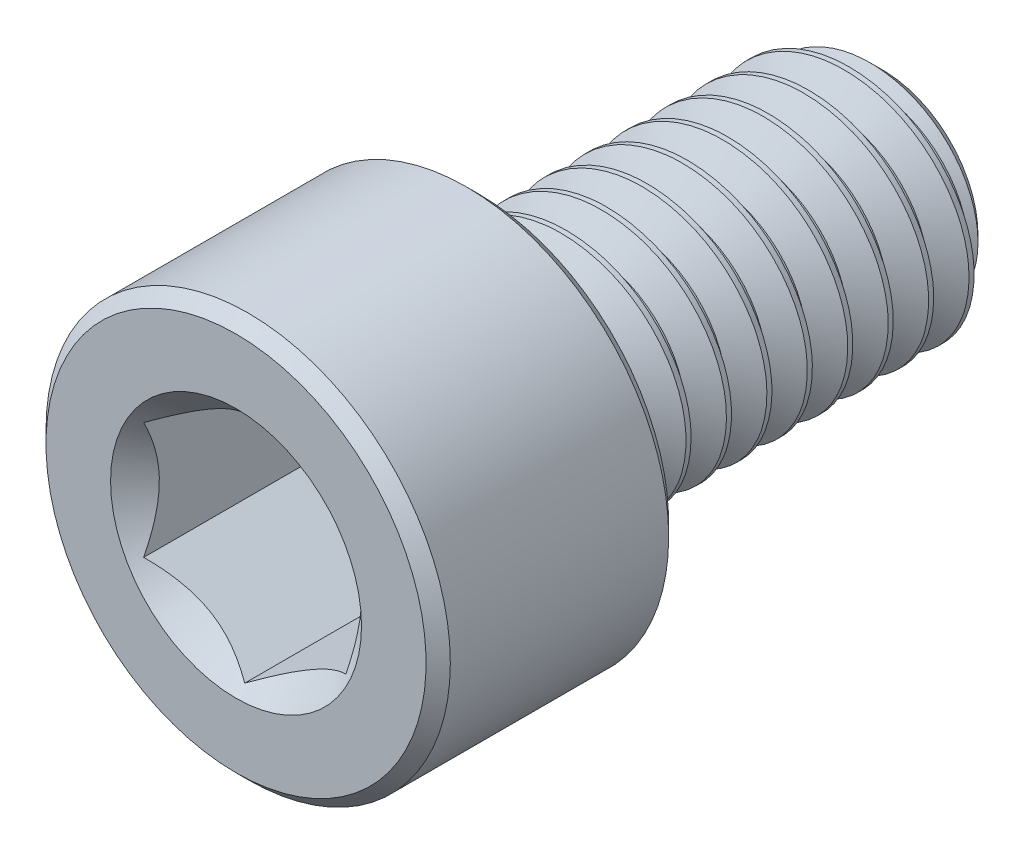
from build123d import *

# Parameters (mm, degrees)
CUT_EXTRUDE1_DEPTH     = 5
SKETCH4_R              = 3.103257697
CUT_EXTRUDE2_DEPTH     = 3
CUT_EXTRUDE2_DRAFT     = -45
SPLIT1_SURFACE_1_BACK  = 22.354
SPLIT1_SURFACE_1_DEPTH = 44.708
SPLIT1_SURFACE_2_BACK  = 22.354
SPLIT1_SURFACE_2_DEPTH = 44.708
CUT_SWEEP1_PITCH       = 1


with BuildPart() as part:
    # Sketch2 → Revolve1 (revolve)
    with BuildSketch(Plane(origin=(0, 0, 0), x_dir=(0, 0, -1), z_dir=(1, 0, 0))):
        with BuildLine():
            Line((-8, 0), (-8, 4.7))
            Line((-8, 4.7), (-7.7, 5))
            Line((-7.7, 5), (-2.3, 5))
            Line((-2.3, 5), (-2, 4.7))
            Line((-2, 4.7), (-2, 3.3))
            ThreePointArc((-2, 3.3), (-1.912132034, 3.087867966), (-1.7, 3))
            Line((-1.7, 3), (7.350480947, 3))
            Line((7.350480947, 3), (8, 2.350480947))
            Line((8, 2.350480947), (8, 0))
            Line((8, 0), (-8, 0))
        make_face()
    revolve(axis=Axis((0, 0, -8), (0, 0, 1)))

    # Sketch3 → Cut-Extrude1 (cut)
    with BuildSketch(Plane.XY.offset(8)):
        Polygon((2.5, -1.443375673), (2.5, 1.443375673), (0, 2.886751346), (-2.5, 1.443375673), (-2.5, -1.443375673), (0, -2.886751346), align=None)
    extrude(amount=-CUT_EXTRUDE1_DEPTH, mode=Mode.SUBTRACT)


with BuildPart() as cut_extrude2_tool:
    # Sketch4 → Cut-Extrude2 (with draft: the straight prism first)
    with BuildSketch(Plane.XY.offset(8)):
        Circle(SKETCH4_R)
    extrude(amount=-CUT_EXTRUDE2_DEPTH)
    # Cut-Extrude2: the draft: its side faces are tilted about the plane it starts from
    cut_extrude2_sides = [cut_extrude2_tool.faces().sort_by_distance(p)[0] for p in [
        (-3.103257697, 0, 6.5),
    ]]
    draft(cut_extrude2_sides, Plane.XY.offset(8), CUT_EXTRUDE2_DRAFT)


with BuildPart() as part_1:
    add(part.part)

    # Cut-Extrude2: cut by cut_extrude2_tool
    add(cut_extrude2_tool.part, mode=Mode.SUBTRACT)


with BuildPart() as body_2:
    # Split1: the piece behind the surface
    add(part_1.part)
    # Split1 surface: a surface, the sketch's curves swept straight by 44.708 mm
    with BuildLine(Plane(origin=(0, 0, 0), x_dir=(0, 0, -1), z_dir=(1, 0, 0)).offset(-SPLIT1_SURFACE_1_BACK), mode=Mode.PRIVATE) as split1_surface_1_path:
        Line((-1.7, -5), (-1.7, 5))
    split1_surface_1 = Shell.extrude(split1_surface_1_path.wire(), (1 * SPLIT1_SURFACE_1_DEPTH, 0 * SPLIT1_SURFACE_1_DEPTH, 0 * SPLIT1_SURFACE_1_DEPTH))
    split(bisect_by=split1_surface_1, keep=Keep.BOTTOM)

    # Cut-Sweep1: the profile of Sketch7 screwed along a right-hand helix of 11 turns, 8 arcs to a turn; built about Z, then put on its axis
    cut_sweep1_z = Axis((0, 0, 0), (0, 0, 1))
    cut_sweep1_corners = [(3.054126588, 0, 0.03125), (3.054126588, 0, -0.90625), (2.350480947, 0, -0.5), (2.350480947, 0, -0.375)]
    with BuildLine(mode=Mode.PRIVATE) as cut_sweep1_profile:
        Line(cut_sweep1_corners[0], cut_sweep1_corners[1])
        Line(cut_sweep1_corners[1], cut_sweep1_corners[2])
        Line(cut_sweep1_corners[2], cut_sweep1_corners[3])
        Line(cut_sweep1_corners[3], cut_sweep1_corners[0])
    cut_sweep1_cap = Face(cut_sweep1_profile.wire())
    cut_sweep1_turn_angles = [0, 22.5, 45, 67.5, 90, 112.5, 135, 157.5, 180, 202.5, 225, 247.5, 270, 292.5, 315, 337.5, 360]
    cut_sweep1_turn_weights = [1, 0.9238795325112867, 1, 0.9238795325112867, 1, 0.9238795325112867, 1, 0.9238795325112867, 1, 0.9238795325112867, 1, 0.9238795325112867, 1, 0.9238795325112867, 1, 0.9238795325112867, 1]
    cut_sweep1_turn_rails = [Edge.make_bspline([Vector(p[0], p[1], 0).rotate(cut_sweep1_z, cut_sweep1_turn_angles[k]) / cut_sweep1_turn_weights[k] + Vector(0, 0, p[2] + CUT_SWEEP1_PITCH * cut_sweep1_turn_angles[k] / 360) for k in range(17)], [0, 0, 0, 1, 1, 2, 2, 3, 3, 4, 4, 5, 5, 6, 6, 7, 7, 8, 8, 8], 2, cut_sweep1_turn_weights) for p in cut_sweep1_corners]
    cut_sweep1_turn_sides = [Face.make_surface_from_curves(cut_sweep1_turn_rails[p[0]], cut_sweep1_turn_rails[p[1]]) for p in [(0, 1), (1, 2), (2, 3), (3, 0)]]
    cut_sweep1 = Plane(origin=(0, 0, -8), x_dir=(0, 1, 0), z_dir=(0, 0, 1)) * Solid(Shell([*[p.moved(Location((0, 0, CUT_SWEEP1_PITCH * i))) for i in range(11) for p in cut_sweep1_turn_sides], cut_sweep1_cap, cut_sweep1_cap.rotate(cut_sweep1_z, 3960).moved(Location((0, 0, CUT_SWEEP1_PITCH * 3960 / 360)))]))
    add(cut_sweep1, mode=Mode.SUBTRACT)


with BuildPart() as part_2:
    add(part_1.part)

    # Split1: split by a surface, the side it looks to stays
    # Split1 surface: a surface, the sketch's curves swept straight by 44.708 mm
    with BuildLine(Plane(origin=(0, 0, 0), x_dir=(0, 0, -1), z_dir=(1, 0, 0)).offset(-SPLIT1_SURFACE_2_BACK), mode=Mode.PRIVATE) as split1_surface_2_path:
        Line((-1.7, -5), (-1.7, 5))
    split1_surface_2 = Shell.extrude(split1_surface_2_path.wire(), (1 * SPLIT1_SURFACE_2_DEPTH, 0 * SPLIT1_SURFACE_2_DEPTH, 0 * SPLIT1_SURFACE_2_DEPTH))
    split(bisect_by=split1_surface_2, keep=Keep.TOP)

    add(body_2.part)  # Revolve2 merges body 2
    # Sketch8 → Revolve2 (revolve)
    with BuildSketch(Plane(origin=(0, 0, 0), x_dir=(0, 0, -1), z_dir=(1, 0, 0))):
        Polygon((-2, 0), (-2, 3), (-1.7, 3), (0.032050808, 0), align=None)
    revolve(axis=Axis((0, 0, -0.032050808), (0, 0, 1)))


solid = part_2.part
